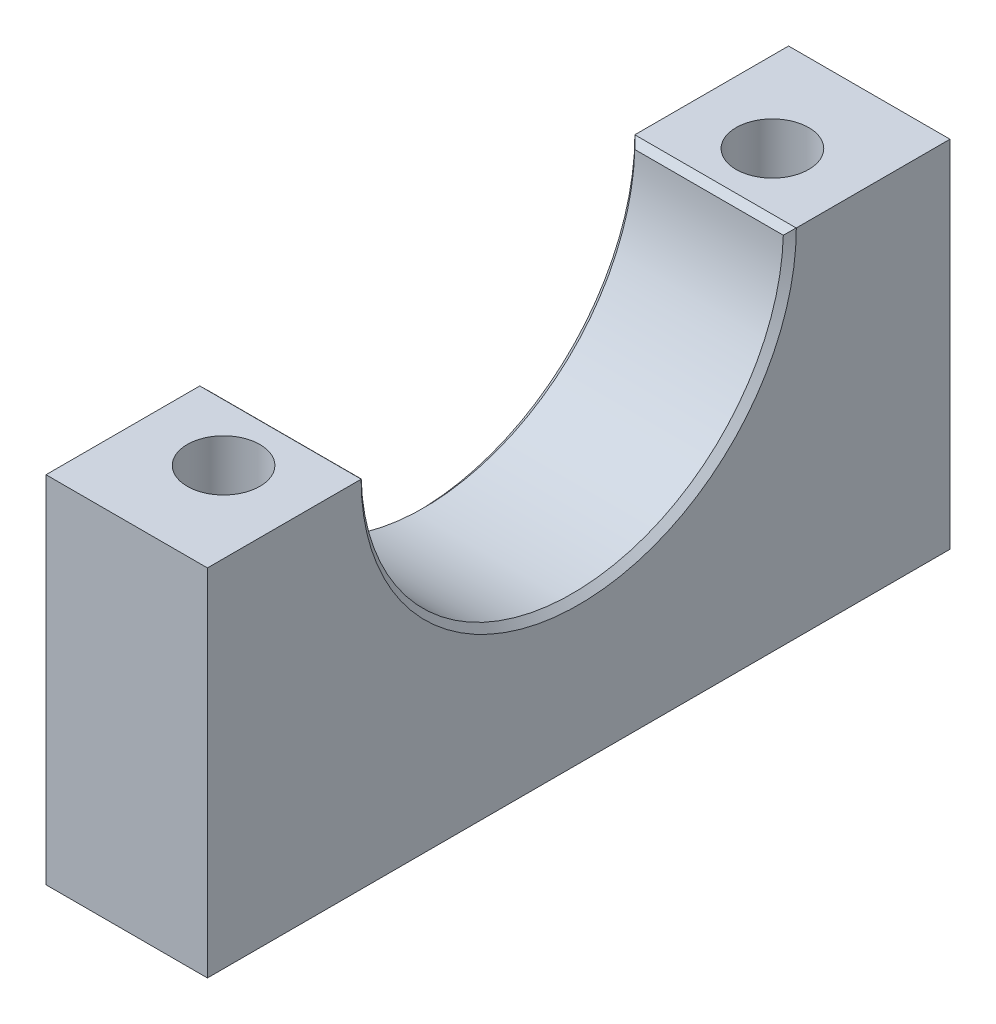
from build123d import *

# Parameters (mm, degrees)
BOSS_EXTRUDE1_DEPTH                           = 15.875
BOSS_EXTRUDE2_DEPTH                           = 15.875
CBORE_FOR_1_4_SOCKET_HEAD_CAP_SCREW1_AT_COUNT = 2
CBORE_FOR_1_4_SOCKET_HEAD_CAP_SCREW1_AT_PITCH = 53.975
MOVE_FACE1_BY                                 = 0.127
MOVE_FACE1_2_BY                               = 0.127
MOVE_START                                    = 28.575
MOVE_FACE2_OUTLINE_W                          = 15.875
MOVE_FACE2_OUTLINE_H                          = 73.025
MOVE_FACE2_OUTLINE_R                          = 5.55625
MOVE_FACE2_DEPTH                              = 6.35
MOVE_START_2                                  = 22.225
MOVE_FACE2_2_OUTLINE_R                        = 5.55625
MOVE_FACE2_2_OUTLINE_R_2                      = 3.57124
MOVE_FACE2_2_DEPTH                            = 6.35


with BuildPart() as part:
    # Sketch1 → Boss-Extrude1 (new body)
    with BuildSketch(Plane(origin=(0, 0, 0), x_dir=(0, 0, -1), z_dir=(1, 0, 0))):
        with BuildLine():
            Line((36.5125, 0), (20.6375, 0))
            ThreePointArc((20.6375, 0), (0, -20.6375), (-20.6375, 0))
            Line((-20.6375, 0), (-36.5125, 0))
            Line((-36.5125, 0), (-36.5125, -34.925))
            Line((-36.5125, -34.925), (36.5125, -34.925))
            Line((36.5125, -34.925), (36.5125, 0))
        make_face()
    extrude(amount=BOSS_EXTRUDE1_DEPTH)


with BuildPart() as body_2:
    # Sketch1<3> → Boss-Extrude2 (new body)
    with BuildSketch(Plane(origin=(0, 0, 0), x_dir=(0, 0, -1), z_dir=(1, 0, 0))):
        with BuildLine():
            ThreePointArc((-20.6375, 0), (0, 20.6375), (20.6375, 0))
            Line((20.6375, 0), (36.5125, 0))
            Line((36.5125, 0), (36.5125, 34.925))
            Line((36.5125, 34.925), (-36.5125, 34.925))
            Line((-36.5125, 34.925), (-36.5125, 0))
            Line((-36.5125, 0), (-20.6375, 0))
        make_face()
    extrude(amount=BOSS_EXTRUDE2_DEPTH)


with BuildPart() as cbore_for_1_4_socket_head_cap_screw1_tool:
    # Sketch4 → CBORE for 1/4 Socket Head Cap Screw1 (revolve)
    with BuildSketch(Plane(origin=(7.9375, 34.925, 26.9875), x_dir=(0, 0, 1), z_dir=(1, 0, 0))):
        Polygon((0, 0), (0, 69.85), (3.57124, 69.85), (3.57124, 6.35), (5.55625, 6.35), (5.55625, 0.635), (6.19125, 0), align=None)
    cbore_for_1_4_socket_head_cap_screw1 = revolve(axis=Axis((7.9375, 41.275, 26.9875), (0, -1, 0)))


with BuildPart() as part_1:
    add(part.part)

    # CBORE for 1/4 Socket Head Cap Screw1: cut by cbore_for_1_4_socket_head_cap_screw1_tool
    add(cbore_for_1_4_socket_head_cap_screw1_tool.part, mode=Mode.SUBTRACT)


with BuildPart() as body_2_1:
    add(body_2.part)

    # CBORE for 1/4 Socket Head Cap Screw1: cut by cbore_for_1_4_socket_head_cap_screw1_tool
    add(cbore_for_1_4_socket_head_cap_screw1_tool.part, mode=Mode.SUBTRACT)


with BuildPart() as cbore_for_1_4_socket_head_cap_screw1_at_tool:
    # CBORE for 1/4 Socket Head Cap Screw1 at: CBORE for 1/4 Socket Head Cap Screw1 ×2
    with Locations(*[(0, 0, -i * CBORE_FOR_1_4_SOCKET_HEAD_CAP_SCREW1_AT_PITCH) for i in range(1, CBORE_FOR_1_4_SOCKET_HEAD_CAP_SCREW1_AT_COUNT)]):
        add(cbore_for_1_4_socket_head_cap_screw1)


with BuildPart() as part_2:
    add(part_1.part)

    # CBORE for 1/4 Socket Head Cap Screw1 at: cut by cbore_for_1_4_socket_head_cap_screw1_at_tool
    add(cbore_for_1_4_socket_head_cap_screw1_at_tool.part, mode=Mode.SUBTRACT)

    # Move Face1 2: a curved face moved inward by 0.127
    add(Solid.thicken(part_2.faces().sort_by_distance((7.9375, -20.6375, 0))[0], -MOVE_FACE1_2_BY), mode=Mode.SUBTRACT)

    # Chamfer1
    # the kernel refuses this chamfer: 0.635 mm, written as the material it takes off along each edge
    with BuildSketch(Plane(origin=(0, 0, 0), x_dir=(0, 0.07868977926472538, -0.9968991516895122), z_dir=(0, 0.9968991516895122, 0.07868977926472538))) as chamfer1_piece_1:
        with BuildLine():
            Line((21.417460512, 0.017960512), (20.746539488, -0.652960512))
            Line((20.746539488, -0.652960512), (20.733839488, -0.652960512))
            ThreePointArc((20.733839488, -0.652960512), (20.7518, -0.326480256), (20.7518, 0))
            Line((20.7518, 0), (20.7645, 0.0127))
            ThreePointArc((20.7645, 0.0127), (21.090980256, 0.0127), (21.417460512, 0.030660512))
            Line((21.417460512, 0.030660512), (21.417460512, 0.017960512))
        make_face()
    revolve(axis=Axis((0, 0, 0), (-1, 0, 0)), revolution_arc=189.026516368, mode=Mode.SUBTRACT)
    with BuildSketch(Plane(origin=(-1.610111621, 0, -20.7645), x_dir=(0, 0, -1), z_dir=(1, 0, 0))) as chamfer1_piece_2:
        with BuildLine():
            Line((0.643801601, 0.017692029), (-0.027368853, -0.633849299))
            Line((-0.027368853, -0.633849299), (-0.040063261, -0.633472445))
            ThreePointArc((-0.040063261, -0.633472445), (-0.015119867, -0.316902726), (-0.0127, 0))
            Line((-0.0127, 0), (0, 0.0127))
            ThreePointArc((0, 0.0127), (0.3219008, 0.0127), (0.643801601, 0.030392029))
            Line((0.643801601, 0.030392029), (0.643801601, 0.017692029))
        make_face()
    extrude(amount=19.095223242, mode=Mode.SUBTRACT)
    with BuildSketch(Plane(origin=(-1.610111621, 0, 20.7645), x_dir=(0, -0.9998899044534173, -0.01483842889716635), z_dir=(1, 0, 0))) as chamfer1_piece_3:
        with BuildLine():
            Line((0.634185626, 0.017960512), (-0.027243086, -0.643468199))
            Line((-0.027243086, -0.643468199), (-0.039941687, -0.643279751))
            ThreePointArc((-0.039941687, -0.643279751), (-0.017475104, -0.321676913), (-0.012698602, 0.000188448))
            Line((-0.012698602, 0.000188448), (0.000188448, 0.012698602))
            ThreePointArc((0.000188448, 0.012698602), (0.317092192, 0.010415864), (0.633997178, 0.030659114))
            Line((0.633997178, 0.030659114), (0.634185626, 0.017960512))
        make_face()
    extrude(amount=19.095223242, mode=Mode.SUBTRACT)
    with BuildSketch(Plane(origin=(15.875, 0, 0), x_dir=(0, 0.0786897792647254, -0.9968991516895122), z_dir=(0, 0.9968991516895122, 0.0786897792647254))) as chamfer1_piece_4:
        with BuildLine():
            Line((20.746539488, 0.652960512), (21.417460512, -0.017960512))
            Line((21.417460512, -0.017960512), (21.417460512, -0.030660512))
            ThreePointArc((21.417460512, -0.030660512), (21.090980256, -0.0127), (20.7645, -0.0127))
            Line((20.7645, -0.0127), (20.7518, 0))
            ThreePointArc((20.7518, 0), (20.7518, 0.326480256), (20.733839488, 0.652960512))
            Line((20.733839488, 0.652960512), (20.746539488, 0.652960512))
        make_face()
    revolve(axis=Axis((15.875, 0, 0), (-1, 0, 0)), revolution_arc=189.026516368, mode=Mode.SUBTRACT)


with BuildPart() as body_2_2:
    add(body_2_1.part)

    # CBORE for 1/4 Socket Head Cap Screw1 at: cut by cbore_for_1_4_socket_head_cap_screw1_at_tool
    add(cbore_for_1_4_socket_head_cap_screw1_at_tool.part, mode=Mode.SUBTRACT)

    # Move Face1: a curved face moved inward by 0.127
    add(Solid.thicken(body_2_2.faces().sort_by_distance((7.9375, 20.6375, 0))[0], -MOVE_FACE1_BY), mode=Mode.SUBTRACT)

    # Move Face2: read off the stored shape, not the designer's step
    # Move Face2 outline → Move Face2 (cut)
    with BuildSketch(Plane(origin=(0, 0, 0), x_dir=(1, 0, 0), z_dir=(0, 1, 0)).offset(MOVE_START)):
        with Locations((7.9375, 0)):
            Rectangle(MOVE_FACE2_OUTLINE_W, MOVE_FACE2_OUTLINE_H)
        with Locations((7.9375, -26.9875)):
            Circle(MOVE_FACE2_OUTLINE_R, mode=Mode.SUBTRACT)
        with Locations((7.9375, 26.9875)):
            Circle(MOVE_FACE2_OUTLINE_R, mode=Mode.SUBTRACT)
    extrude(amount=MOVE_FACE2_DEPTH, mode=Mode.SUBTRACT)

    # Move Face2 2 outline → Move Face2 2 (cut)
    # profile 1 of 2: a face of its own
    with BuildSketch(Plane(origin=(0, 0, 0), x_dir=(1, 0, 0), z_dir=(0, 1, 0)).offset(MOVE_START_2)):
        with Locations((7.9375, 26.9875)):
            Circle(MOVE_FACE2_2_OUTLINE_R)
        with Locations((7.9375, 26.9875)):
            Circle(MOVE_FACE2_2_OUTLINE_R_2, mode=Mode.SUBTRACT)
    # profile 2 of 2: a face of its own
    with BuildSketch(Plane(origin=(0, 0, 0), x_dir=(1, 0, 0), z_dir=(0, 1, 0)).offset(MOVE_START_2)):
        with Locations((7.9375, -26.9875)):
            Circle(MOVE_FACE2_2_OUTLINE_R)
        with Locations((7.9375, -26.9875)):
            Circle(MOVE_FACE2_2_OUTLINE_R_2, mode=Mode.SUBTRACT)
    extrude(amount=MOVE_FACE2_2_DEPTH, mode=Mode.SUBTRACT)

    # Move Face2 3: loft between two sections, ruled curve by curve
    move_face2_3_from = [
        Edge.make_three_point_arc((7.9375, 27.94, -21.43125), (13.49375, 27.94, -26.9875), (7.9375, 27.94, -32.54375)),
        Edge.make_three_point_arc((7.9375, 27.94, -32.54375), (2.38125, 27.94, -26.9875), (7.9375, 27.94, -21.43125)),
    ]
    move_face2_3_to = [
        Edge.make_three_point_arc((7.9375, 28.575, -20.79625), (14.12875, 28.575, -26.9875), (7.9375, 28.575, -33.17875)),
        Edge.make_three_point_arc((7.9375, 28.575, -33.17875), (1.74625, 28.575, -26.9875), (7.9375, 28.575, -20.79625)),
    ]
    move_face2_3 = Solid(Shell([*[Face.make_surface_from_curves(move_face2_3_from[k], move_face2_3_to[k]) for k in range(2)], Face(Wire(move_face2_3_from)), Face(Wire(move_face2_3_to))]))
    add(move_face2_3, mode=Mode.SUBTRACT)

    # Move Face2 4: loft between two sections, ruled curve by curve
    move_face2_4_from = [
        Edge.make_three_point_arc((7.9375, 27.94, 32.54375), (13.49375, 27.94, 26.9875), (7.9375, 27.94, 21.43125)),
        Edge.make_three_point_arc((7.9375, 27.94, 21.43125), (2.38125, 27.94, 26.9875), (7.9375, 27.94, 32.54375)),
    ]
    move_face2_4_to = [
        Edge.make_three_point_arc((7.9375, 28.575, 33.17875), (14.12875, 28.575, 26.9875), (7.9375, 28.575, 20.79625)),
        Edge.make_three_point_arc((7.9375, 28.575, 20.79625), (1.74625, 28.575, 26.9875), (7.9375, 28.575, 33.17875)),
    ]
    move_face2_4 = Solid(Shell([*[Face.make_surface_from_curves(move_face2_4_from[k], move_face2_4_to[k]) for k in range(2)], Face(Wire(move_face2_4_from)), Face(Wire(move_face2_4_to))]))
    add(move_face2_4, mode=Mode.SUBTRACT)

    # Chamfer2
    # the kernel refuses this chamfer: 0.635 mm, written as the material it takes off along each edge
    with BuildSketch(Plane(origin=(0, 0, 0), x_dir=(0, -0.0786897792647251, 0.9968991516895122), z_dir=(0, -0.9968991516895122, -0.0786897792647251))) as chamfer2_piece_1:
        with BuildLine():
            Line((21.417460512, 0.017960512), (20.746539488, -0.652960512))
            Line((20.746539488, -0.652960512), (20.733839488, -0.652960512))
            ThreePointArc((20.733839488, -0.652960512), (20.7518, -0.326480256), (20.7518, 0))
            Line((20.7518, 0), (20.7645, 0.0127))
            ThreePointArc((20.7645, 0.0127), (21.090980256, 0.0127), (21.417460512, 0.030660512))
            Line((21.417460512, 0.030660512), (21.417460512, 0.017960512))
        make_face()
    revolve(axis=Axis((0, 0, 0), (-1, 0, 0)), revolution_arc=189.026516368, mode=Mode.SUBTRACT)
    with BuildSketch(Plane(origin=(-1.610111621, 0, 20.7645), x_dir=(0, 0, 1), z_dir=(1, 0, 0))) as chamfer2_piece_2:
        with BuildLine():
            Line((0.643801601, 0.017692029), (-0.027368853, -0.633849299))
            Line((-0.027368853, -0.633849299), (-0.040063261, -0.633472445))
            ThreePointArc((-0.040063261, -0.633472445), (-0.015119867, -0.316902726), (-0.0127, 0))
            Line((-0.0127, 0), (0, 0.0127))
            ThreePointArc((0, 0.0127), (0.3219008, 0.0127), (0.643801601, 0.030392029))
            Line((0.643801601, 0.030392029), (0.643801601, 0.017692029))
        make_face()
    extrude(amount=19.095223242, mode=Mode.SUBTRACT)
    with BuildSketch(Plane(origin=(-1.610111621, 0, -20.7645), x_dir=(0, 0.9998899044534173, 0.014838428897166573), z_dir=(1, 0, 0))) as chamfer2_piece_3:
        with BuildLine():
            Line((0.634185626, 0.017960512), (-0.027243086, -0.643468199))
            Line((-0.027243086, -0.643468199), (-0.039941687, -0.643279751))
            ThreePointArc((-0.039941687, -0.643279751), (-0.017475104, -0.321676913), (-0.012698602, 0.000188448))
            Line((-0.012698602, 0.000188448), (0.000188448, 0.012698602))
            ThreePointArc((0.000188448, 0.012698602), (0.317092192, 0.010415864), (0.633997178, 0.030659114))
            Line((0.633997178, 0.030659114), (0.634185626, 0.017960512))
        make_face()
    extrude(amount=19.095223242, mode=Mode.SUBTRACT)
    with BuildSketch(Plane(origin=(15.875, 0, 0), x_dir=(0, -0.07868977926472513, 0.9968991516895122), z_dir=(0, -0.9968991516895122, -0.07868977926472513))) as chamfer2_piece_4:
        with BuildLine():
            Line((20.746539488, 0.652960512), (21.417460512, -0.017960512))
            Line((21.417460512, -0.017960512), (21.417460512, -0.030660512))
            ThreePointArc((21.417460512, -0.030660512), (21.090980256, -0.0127), (20.7645, -0.0127))
            Line((20.7645, -0.0127), (20.7518, 0))
            ThreePointArc((20.7518, 0), (20.7518, 0.326480256), (20.733839488, 0.652960512))
            Line((20.733839488, 0.652960512), (20.746539488, 0.652960512))
        make_face()
    revolve(axis=Axis((15.875, 0, 0), (-1, 0, 0)), revolution_arc=189.026516368, mode=Mode.SUBTRACT)


solid = part_2.part
